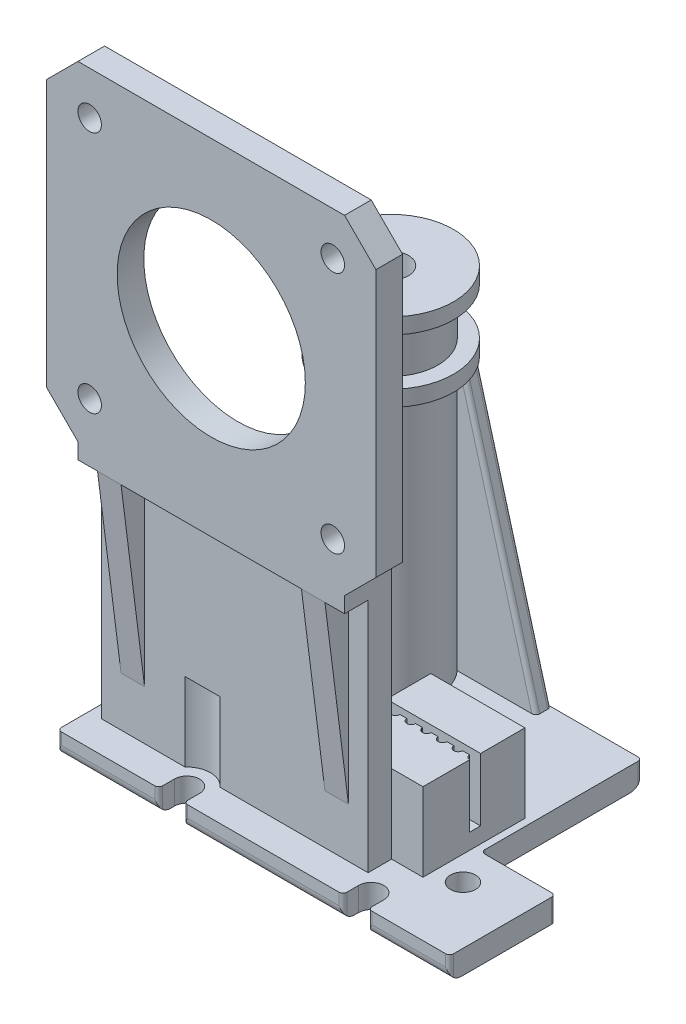
from build123d import *

# Parameters (mm, degrees)
SKETCH2_R            = 2.25
SKETCH2_R_2          = 1.6
BOSS_EXTRUDE1_DEPTH  = 3
FILLET1_R            = 1.5
SKETCH5_R            = 6
SKETCH5_R_2          = 2.25
BOSS_EXTRUDE3_DEPTH  = 34.5
SKETCH6_R            = 8
SKETCH6_R_2          = 2.25
BOSS_EXTRUDE4_DEPTH  = 2
SKETCH7_R            = 6
SKETCH7_R_2          = 2.25
BOSS_EXTRUDE5_DEPTH  = 6
SKETCH13_W           = 34
SKETCH13_H           = 3
BOSS_EXTRUDE8_DEPTH  = 30.1
SKETCH16_W           = 34
SKETCH16_H           = 6
BOSS_EXTRUDE10_DEPTH = 2
SKETCH17_W           = 3
SKETCH17_H           = 23.8
BOSS_EXTRUDE11_DEPTH = 3
CUT_EXTRUDE5_REACH   = 72.635
SKETCH19_W           = 42
SKETCH19_H           = 3.4
BOSS_EXTRUDE12_DEPTH = 42
SKETCH21_R           = 12
SKETCH21_R_2         = 1.5
CUT_EXTRUDE6_DEPTH   = 3.4
SKETCH28_R           = 8
SKETCH28_R_2         = 2.25
BOSS_EXTRUDE19_DEPTH = 2
BOSS_EXTRUDE20_DEPTH = 2
FILLET4_R            = 0.5
SKETCH30_W           = 12
SKETCH30_H           = 13
BOSS_EXTRUDE23_DEPTH = 10
CUT_EXTRUDE7_DEPTH   = 8
SKETCH14_R           = 3
CUT_EXTRUDE9_DEPTH   = 10
SKETCH32_W           = 21.4
SKETCH32_H           = 13
BOSS_EXTRUDE24_DEPTH = 2
CUT_EXTRUDE10_DEPTH  = 21.4
FILLET5_R            = 0.5


with BuildPart() as part:
    # Sketch2 → Boss-Extrude1 (new body)
    with BuildSketch(Plane(origin=(0, 0, 0), x_dir=(1, 0, 0), z_dir=(0, 1, 0))):
        with BuildLine():
            Line((-1.6, -26.5), (-1.6, -28))
            ThreePointArc((-1.6, -28), (-1.746446609, -28.353553391), (-2.1, -28.5))
            Line((-2.1, -28.5), (-14, -28.5))
            ThreePointArc((-14, -28.5), (-14.353553391, -28.353553391), (-14.5, -28))
            Line((-14.5, -28), (-14.5, 5))
            ThreePointArc((-14.5, 5), (-14.353553391, 5.353553391), (-14, 5.5))
            Line((-14, 5.5), (25.5, 5.5))
            ThreePointArc((25.5, 5.5), (25.853553391, 5.353553391), (26, 5))
            Line((26, 5), (26, -14.5))
            ThreePointArc((26, -14.5), (26.146446609, -14.853553391), (26.5, -15))
            Line((26.5, -15), (35, -15))
            ThreePointArc((35, -15), (35.353553391, -15.146446609), (35.5, -15.5))
            Line((35.5, -15.5), (35.5, -28))
            ThreePointArc((35.5, -28), (35.353553391, -28.353553391), (35, -28.5))
            Line((35, -28.5), (25.6, -28.5))
            ThreePointArc((25.6, -28.5), (25.246446609, -28.353553391), (25.1, -28))
            Line((25.1, -28), (25.1, -26.5))
            ThreePointArc((25.1, -26.5), (23.5, -24.9), (21.9, -26.5))
            Line((21.9, -26.5), (21.9, -28))
            ThreePointArc((21.9, -28), (21.753553391, -28.353553391), (21.4, -28.5))
            Line((21.4, -28.5), (2.1, -28.5))
            ThreePointArc((2.1, -28.5), (1.746446609, -28.353553391), (1.6, -28))
            Line((1.6, -28), (1.6, -26.5))
            ThreePointArc((1.6, -26.5), (0, -24.9), (-1.6, -26.5))
        make_face()
        with Locations(Location((0, -0.5, 0), (0, 0, 270))):
            Circle(SKETCH2_R, mode=Mode.SUBTRACT)
        with Locations(Location((-9, -0.5, 0), (0, 0, 270))):
            Circle(SKETCH2_R_2, mode=Mode.SUBTRACT)
        with Locations(Location((9, -0.5, 0), (0, 0, 270))):
            Circle(SKETCH2_R_2, mode=Mode.SUBTRACT)
        with Locations(Location((10, -19.5, 0), (0, 0, 270))):
            Circle(SKETCH2_R_2, mode=Mode.SUBTRACT)
        with Locations(Location((28.2, -19.5, 0), (0, 0, 270))):
            Circle(SKETCH2_R_2, mode=Mode.SUBTRACT)
    extrude(amount=BOSS_EXTRUDE1_DEPTH)

    # Fillet1
    # the kernel refuses this fillet: 1.5 mm, written as the material it takes off along each edge
    with BuildSketch(Plane(origin=(-17.75, 0, -5.5), x_dir=(0, 1, 0), z_dir=(1, 0, 0))) as fillet1_piece_1:
        with BuildLine():
            CenterArc((FILLET1_R, FILLET1_R), FILLET1_R, 180, 90)
            Line((0, FILLET1_R), (0, 0))
            Line((0, 0), (FILLET1_R, 0))
        make_face()
    extrude(amount=47, mode=Mode.SUBTRACT)
    with BuildSketch(Plane(origin=(1.65, 0, 28.5), x_dir=(0, 1, 0), z_dir=(-1, 0, 0))) as fillet1_piece_2:
        with BuildLine():
            CenterArc((FILLET1_R, FILLET1_R), FILLET1_R, 180, 90)
            Line((0, FILLET1_R), (0, 0))
            Line((0, 0), (FILLET1_R, 0))
        make_face()
    extrude(amount=19.4, mode=Mode.SUBTRACT)
    with BuildSketch(Plane(origin=(38.75, 0, 28.5), x_dir=(0, 1, 0), z_dir=(-1, 0, 0))) as fillet1_piece_3:
        with BuildLine():
            CenterArc((FILLET1_R, FILLET1_R), FILLET1_R, 180, 90)
            Line((0, FILLET1_R), (0, 0))
            Line((0, 0), (FILLET1_R, 0))
        make_face()
    extrude(amount=16.9, mode=Mode.SUBTRACT)
    with BuildSketch(Plane(origin=(25.15, 0, 28.5), x_dir=(0, 1, 0), z_dir=(-1, 0, 0))) as fillet1_piece_4:
        with BuildLine():
            CenterArc((FILLET1_R, FILLET1_R), FILLET1_R, 180, 90)
            Line((0, FILLET1_R), (0, 0))
            Line((0, 0), (FILLET1_R, 0))
        make_face()
    extrude(amount=26.8, mode=Mode.SUBTRACT)

    # Sketch5 → Boss-Extrude3 (add)
    with BuildSketch(Plane(origin=(0, 3, 0), x_dir=(1, 0, 0), z_dir=(0, 1, 0))):
        with Locations(Location((0, -0.5, 0), (0, 0, 90))):
            Circle(SKETCH5_R)
        with Locations(Location((0, -0.5, 0), (0, 0, 270))):
            Circle(SKETCH5_R_2, mode=Mode.SUBTRACT)
    extrude(amount=BOSS_EXTRUDE3_DEPTH)

    # Sketch6 → Boss-Extrude4 (add)
    with BuildSketch(Plane(origin=(0, 37.5, 0), x_dir=(1, 0, 0), z_dir=(0, 1, 0))):
        with Locations(Location((0, -0.5, 0), (0, 0, 270))):
            Circle(SKETCH6_R)
        with Locations(Location((0, -0.5, 0), (0, 0, 270))):
            Circle(SKETCH6_R_2, mode=Mode.SUBTRACT)
    extrude(amount=BOSS_EXTRUDE4_DEPTH)

    # Sketch7 → Boss-Extrude5 (add)
    with BuildSketch(Plane(origin=(0, 39.5, 0), x_dir=(1, 0, 0), z_dir=(0, 1, 0))):
        with Locations(Location((0, -0.5, 0), (0, 0, 90))):
            Circle(SKETCH7_R)
        with Locations(Location((0, -0.5, 0), (0, 0, 270))):
            Circle(SKETCH7_R_2, mode=Mode.SUBTRACT)
    extrude(amount=BOSS_EXTRUDE5_DEPTH)

    # Sketch13 → Boss-Extrude8 (add)
    with BuildSketch(Plane(origin=(0, 3, 0), x_dir=(1, 0, 0), z_dir=(0, 1, 0))):
        with Locations((4.1, -23)):
            Rectangle(SKETCH13_W, SKETCH13_H)
    extrude(amount=BOSS_EXTRUDE8_DEPTH)

    # Sketch16 → Boss-Extrude10 (add)
    with BuildSketch(Plane(origin=(0, 33.1, 0), x_dir=(1, 0, 0), z_dir=(0, 1, 0))):
        with Locations((4.1, -24.5)):
            Rectangle(SKETCH16_W, SKETCH16_H)
    extrude(amount=BOSS_EXTRUDE10_DEPTH)

    # Sketch17 → Boss-Extrude11 (add)
    with BuildSketch(Plane.XY.offset(24.5)):
        with Locations((-8.9, 21.2)):
            Rectangle(SKETCH17_W, SKETCH17_H)
        with Locations((17.1, 21.2)):
            Rectangle(SKETCH17_W, SKETCH17_H)
    extrude(amount=BOSS_EXTRUDE11_DEPTH)

    # Cut-Extrude5: up to this face of the body (flat: up to its plane)
    cut_extrude5_end = Plane(part.part.faces().sort_by_distance((21.1, 19.932697947, 23.175953079))[0])
    # Sketch18 → Cut-Extrude5 (cut, up to the picked face)
    with BuildSketch(Plane.ZY.offset(10.4), mode=Mode.PRIVATE) as cut_extrude5_sk1:
        Polygon((24.5, 9.3), (27.5, 33.1), (27.5, 9.3), align=None)
    cut_extrude5_tool1 = split(extrude(cut_extrude5_sk1.sketch, amount=-CUT_EXTRUDE5_REACH, mode=Mode.PRIVATE), bisect_by=cut_extrude5_end, keep=Keep.BOTH, mode=Mode.PRIVATE)
    add(cut_extrude5_tool1.solids().sort_by(Axis((-10.4, 17.233333, 26.5), (1, 0, 0)))[0], mode=Mode.SUBTRACT)

    # Sketch19 → Boss-Extrude12 (add)
    with BuildSketch(Plane(origin=(0, 35.1, 0), x_dir=(1, 0, 0), z_dir=(0, 1, 0))):
        with Locations((4.1, -25.8)):
            Rectangle(SKETCH19_W, SKETCH19_H)
    extrude(amount=BOSS_EXTRUDE12_DEPTH)

    # Sketch21 → Cut-Extrude6 (cut)
    with BuildSketch(Plane.XY.offset(27.5)):
        with Locations((4.1, 56.1)):
            Circle(SKETCH21_R)
        with Locations((-11.4, 71.6)):
            Circle(SKETCH21_R_2)
        with Locations((19.6, 40.6)):
            Circle(SKETCH21_R_2)
        with Locations((19.6, 71.6)):
            Circle(SKETCH21_R_2)
        with Locations((-11.4, 40.6)):
            Circle(SKETCH21_R_2)
        Polygon((-16.9, 77.1), (-12.9, 77.1), (-16.9, 73.1), align=None)
        Polygon((25.1, 77.1), (25.1, 73.1), (21.1, 77.1), align=None)
        Polygon((25.1, 35.1), (21.1, 35.1), (25.1, 39.1), align=None)
        Polygon((-16.9, 35.1), (-12.9, 35.1), (-16.9, 39.1), align=None)
    extrude(amount=-CUT_EXTRUDE6_DEPTH, mode=Mode.SUBTRACT)

    # Sketch28 → Boss-Extrude19 (add)
    with BuildSketch(Plane(origin=(0, 45.5, 0), x_dir=(1, 0, 0), z_dir=(0, 1, 0))):
        with Locations(Location((0, -0.5, 0), (0, 0, 270))):
            Circle(SKETCH28_R)
        with Locations(Location((0, -0.5, 0), (0, 0, 270))):
            Circle(SKETCH28_R_2, mode=Mode.SUBTRACT)
    extrude(amount=BOSS_EXTRUDE19_DEPTH)

    # Sketch29 → Boss-Extrude20 (add)
    with BuildSketch(Plane(origin=(0, 0, -5.5), x_dir=(-1, 0, 0), z_dir=(0, 0, -1))):
        Polygon((14.5, 3), (-14.5, 3), (-5, 37.5), (5, 37.5), align=None)
    extrude(amount=-BOSS_EXTRUDE20_DEPTH)

    # Fillet4
    # the kernel refuses this fillet: 0.5 mm, written as the material it takes off along each edge
    with BuildSketch(Plane(origin=(14.831851532, 1.794854963, -3.5), x_dir=(0, 0, -1), z_dir=(-0.2654812255888909, 0.9641160297701831, 0))) as fillet4_piece_1_section:
        with BuildLine():
            CenterArc((FILLET4_R, FILLET4_R), FILLET4_R, 180, 90)
            Line((0, FILLET4_R), (0, 0))
            Line((0, 0), (FILLET4_R, 0))
        make_face()
    fillet4_piece_1 = extrude(amount=38.28407467, mode=Mode.PRIVATE)
    fillet4_piece_1 = split(fillet4_piece_1, bisect_by=Plane(origin=(9.63258928, 3, -3.613197557), z_dir=(0, 1, 0)), keep=Keep.TOP, mode=Mode.PRIVATE)
    fillet4_piece_1 = split(fillet4_piece_1, bisect_by=Plane(origin=(9.63258928, 37.5, -3.613197557), z_dir=(0, -1, 0)), keep=Keep.TOP, mode=Mode.PRIVATE)
    add(fillet4_piece_1, mode=Mode.SUBTRACT)
    with BuildSketch(Plane(origin=(-4.668148468, 38.705145037, -3.5), x_dir=(0.9641160297701831, -0.265481225588891, 0), z_dir=(-0.265481225588891, -0.9641160297701831, 0))) as fillet4_piece_2_section:
        with BuildLine():
            CenterArc((FILLET4_R, -FILLET4_R), FILLET4_R, 90, 90)
            Line((0, -FILLET4_R), (0, 0))
            Line((0, 0), (FILLET4_R, 0))
        make_face()
    fillet4_piece_2 = extrude(amount=38.28407467, mode=Mode.PRIVATE)
    fillet4_piece_2 = split(fillet4_piece_2, bisect_by=Plane(origin=(-9.63258928, 37.5, -3.613197557), z_dir=(0, -1, 0)), keep=Keep.TOP, mode=Mode.PRIVATE)
    fillet4_piece_2 = split(fillet4_piece_2, bisect_by=Plane(origin=(-9.63258928, 3, -3.613197557), z_dir=(0, 1, 0)), keep=Keep.TOP, mode=Mode.PRIVATE)
    add(fillet4_piece_2, mode=Mode.SUBTRACT)
    with BuildSketch(Plane(origin=(-4.668148468, 38.705145037, -5.5), x_dir=(0.964116029770183, -0.265481225588891, 0), z_dir=(-0.265481225588891, -0.9641160297701831, 0))) as fillet4_piece_3_section:
        with BuildLine():
            CenterArc((FILLET4_R, FILLET4_R), FILLET4_R, 180, 90)
            Line((0, FILLET4_R), (0, 0))
            Line((0, 0), (FILLET4_R, 0))
        make_face()
    fillet4_piece_3 = extrude(amount=38.28407467, mode=Mode.PRIVATE)
    fillet4_piece_3 = split(fillet4_piece_3, bisect_by=Plane(origin=(-9.802566239, 37.5, -5.386853438), z_dir=(0, -1, 0)), keep=Keep.TOP, mode=Mode.PRIVATE)
    add(fillet4_piece_3, mode=Mode.SUBTRACT)
    with BuildSketch(Plane(origin=(14.831851532, 1.794854963, -5.5), x_dir=(-0.9641160297701831, -0.26548122558889087, 0), z_dir=(-0.2654812255888909, 0.9641160297701831, 0))) as fillet4_piece_4_section:
        with BuildLine():
            CenterArc((FILLET4_R, FILLET4_R), FILLET4_R, 180, 90)
            Line((0, FILLET4_R), (0, 0))
            Line((0, 0), (FILLET4_R, 0))
        make_face()
    fillet4_piece_4 = extrude(amount=38.28407467, mode=Mode.PRIVATE)
    fillet4_piece_4 = split(fillet4_piece_4, bisect_by=Plane(origin=(9.63258928, 37.5, -5.386802443), z_dir=(0, -1, 0)), keep=Keep.TOP, mode=Mode.PRIVATE)
    fillet4_piece_4 = split(fillet4_piece_4, bisect_by=Plane(origin=(9.63258928, 3, -5.386802443), z_dir=(0, 1, 0)), keep=Keep.TOP, mode=Mode.PRIVATE)
    add(fillet4_piece_4, mode=Mode.SUBTRACT)

    # Sketch30 → Boss-Extrude23 (add)
    with BuildSketch(Plane(origin=(0, 3, 0), x_dir=(1, 0, 0), z_dir=(0, 1, 0))):
        with Locations((19.1, -15)):
            Rectangle(SKETCH30_W, SKETCH30_H)
    extrude(amount=BOSS_EXTRUDE23_DEPTH)

    # Sketch4 → Cut-Extrude7 (cut)
    with BuildSketch(Plane(origin=(0, 13, 0), x_dir=(1, 0, 0), z_dir=(0, 1, 0))):
        with BuildLine():
            Line((24.545, -15), (23.655, -15))
            ThreePointArc((23.655, -15), (23.1, -15.555), (22.545, -15))
            Line((22.545, -15), (21.655, -15))
            ThreePointArc((21.655, -15), (21.1, -15.555), (20.545, -15))
            Line((20.545, -15), (19.655, -15))
            ThreePointArc((19.655, -15), (19.1, -15.555), (18.545, -15))
            Line((18.545, -15), (17.655, -15))
            ThreePointArc((17.655, -15), (17.1, -15.555), (16.545, -15))
            Line((16.545, -15), (15.655, -15))
            ThreePointArc((15.655, -15), (15.1, -15.555), (14.545, -15))
            Line((14.545, -15), (13.655, -15))
            ThreePointArc((13.655, -15), (13.492444264, -15.392444264), (13.1, -15.555))
            Line((13.1, -15.555), (13.1, -14.155))
            Line((13.1, -14.155), (25.1, -14.155))
            Line((25.1, -14.155), (25.1, -15.555))
            ThreePointArc((25.1, -15.555), (24.707555736, -15.392444264), (24.545, -15))
        make_face()
    extrude(amount=-CUT_EXTRUDE7_DEPTH, mode=Mode.SUBTRACT)

    # Sketch14 → Cut-Extrude9 (cut)
    with BuildSketch(Plane(origin=(0, 3, 0), x_dir=(1, 0, 0), z_dir=(0, 1, 0))):
        with Locations((-9, -0.5)):
            Circle(SKETCH14_R)
        with Locations((9, -0.5)):
            Circle(SKETCH14_R)
        with Locations((10, -19.5)):
            Circle(SKETCH14_R)
        with Locations((0, -26.5)):
            Circle(SKETCH14_R)
        with Locations((28.2, -19.5)):
            Circle(SKETCH14_R)
        with Locations((23.5, -26.5)):
            Circle(SKETCH14_R)
    extrude(amount=CUT_EXTRUDE9_DEPTH, mode=Mode.SUBTRACT)

    # Sketch32 → Boss-Extrude24 (add)
    with BuildSketch(Plane(origin=(0, 3, 0), x_dir=(1, 0, 0), z_dir=(0, 1, 0))):
        with Locations((-3.8, -15)):
            Rectangle(SKETCH32_W, SKETCH32_H)
    extrude(amount=BOSS_EXTRUDE24_DEPTH)

    # Sketch33 → Cut-Extrude10 (cut)
    with BuildSketch(Plane.ZY.offset(14.5)):
        Polygon((11.5, 3), (12, 5), (18, 5), (18.5, 3), align=None)
    extrude(amount=-CUT_EXTRUDE10_DEPTH, mode=Mode.SUBTRACT)

    # Fillet5
    fillet5_edges = [part.edges().sort_by_distance(p)[0] for p in [
        (-14.5, 4, 18.25),
        (-14.5, 4, 11.75),
        (6.9, 4, 11.75),
        (6.9, 4, 18.25),
    ]]
    fillet(fillet5_edges, radius=FILLET5_R)


solid = part.part
